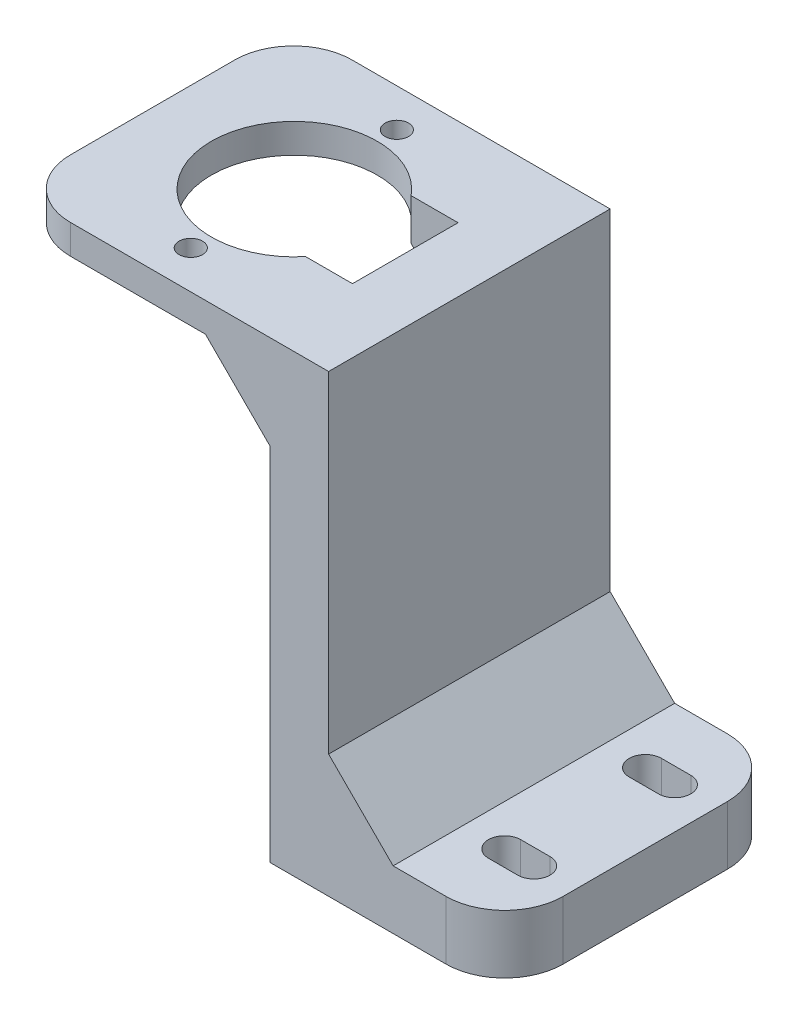
from build123d import *

# Parameters (mm, degrees)
SKETCH1_W                 = 54
SKETCH1_H                 = 48
SKETCH1_R                 = 2
BOSS_EXTRUDE1_DEPTH       = 5
SKETCH2_W                 = 10
SKETCH2_H                 = 48
BOSS_EXTRUDE2_DEPTH       = 72.5
SKETCH3_W                 = 48
SKETCH3_H                 = 10
BOSS_EXTRUDE3_DEPTH       = 30
FILLET1_R                 = 10
CHAMFER1_SIZE             = 11
F_1_0MM_START             = -72.5
F_1_0MM_DOWEL_SLOT1_DEPTH = 10
FILLET2_R                 = 10


# Read off the part's stored shape, not the designer's step: Ø1.0mm Dowel Slot1
with BuildPart() as part:
    # Sketch1 → Boss-Extrude1 (new body)
    with BuildSketch(Plane(origin=(0, 0, 0), x_dir=(1, 0, 0), z_dir=(0, 1, 0))):
        with Locations((3, 0)):
            Rectangle(SKETCH1_W, SKETCH1_H)
        with Locations(Location((0.133743503, 17.499488926, 0), (0, 0, 270))):
            Circle(SKETCH1_R, mode=Mode.SUBTRACT)
        with Locations(Location((0, -17.5, 0), (0, 0, 270))):
            Circle(SKETCH1_R, mode=Mode.SUBTRACT)
        with BuildLine():
            Line((19.068905623, 9), (11.068905623, 9))
            ThreePointArc((11.068905623, 9), (-14, 0), (11.068905623, -9))
            Line((11.068905623, -9), (19.068905623, -9))
            Line((19.068905623, -9), (19.068905623, 9))
        make_face(mode=Mode.SUBTRACT)
    extrude(amount=BOSS_EXTRUDE1_DEPTH)

    # Sketch2 → Boss-Extrude2 (add)
    with BuildSketch(Plane.XZ):
        with Locations((25, 0)):
            Rectangle(SKETCH2_W, SKETCH2_H)
    extrude(amount=BOSS_EXTRUDE2_DEPTH)

    # Sketch3 → Boss-Extrude3 (add)
    with BuildSketch(Plane(origin=(30, 0, 0), x_dir=(0, 0, -1), z_dir=(1, 0, 0))):
        with Locations((0, -67.5)):
            Rectangle(SKETCH3_W, SKETCH3_H)
    extrude(amount=BOSS_EXTRUDE3_DEPTH)

    # Fillet1
    fillet1_edges = [part.edges().sort_by_distance(p)[0] for p in [
        (-24, 2.5, -24),
        (-24, 2.5, 24),
    ]]
    fillet(fillet1_edges, radius=FILLET1_R)

    # Chamfer1
    # the kernel refuses this chamfer: 11 mm, written as the material it adds along each edge
    with BuildSketch(Plane(origin=(20, 0, 24), x_dir=(-0.9996219169112968, 0.027495876610586372, 0), z_dir=(0, 0, -1))) as chamfer1_piece_1_section:
        Polygon((CHAMFER1_SIZE * 0.999621916911, -CHAMFER1_SIZE * 0.0274958766106), (-CHAMFER1_SIZE * 0.0274958766106, -CHAMFER1_SIZE * 0.999621916911), (0, 0), align=None)
    chamfer1_piece_1 = extrude(amount=48, mode=Mode.PRIVATE)
    chamfer1_piece_1 = split(chamfer1_piece_1, bisect_by=Plane(origin=(15.585058089, -3.181005548, 9), z_dir=(0, 0, 1)), keep=Keep.TOP, mode=Mode.PRIVATE)
    chamfer1_piece_1 = chamfer1_piece_1 - Plane(origin=(0.15, -3.181005548, 0), x_dir=(0.7716541076196256, 0, -0.6360424028268551), z_dir=(0, -1, 0)) * Cylinder(14.15, 140, mode=Mode.PRIVATE)
    chamfer1_piece_1 = split(chamfer1_piece_1, bisect_by=Plane(origin=(19.068905623, -3.181005548, 16.524598141), z_dir=(-1, 0, 0)), keep=Keep.TOP, mode=Mode.PRIVATE)
    add(chamfer1_piece_1)
    with BuildSketch(Plane(origin=(20, 0, 24), x_dir=(-0.9996219169112968, 0.027495876610586372, 0), z_dir=(0, 0, -1))) as chamfer1_piece_2_section:
        Polygon((CHAMFER1_SIZE * 0.999621916911, -CHAMFER1_SIZE * 0.0274958766106), (-CHAMFER1_SIZE * 0.0274958766106, -CHAMFER1_SIZE * 0.999621916911), (0, 0), align=None)
    chamfer1_piece_2 = extrude(amount=48, mode=Mode.PRIVATE)
    chamfer1_piece_2 = split(chamfer1_piece_2, bisect_by=Plane(origin=(19.684713813, -5.503387728, 9), z_dir=(0, 0, 1)), keep=Keep.TOP, mode=Mode.PRIVATE)
    chamfer1_piece_2 = split(chamfer1_piece_2, bisect_by=Plane(origin=(19.068905623, -5.503387728, 16.5), z_dir=(1, 0, 0)), keep=Keep.TOP, mode=Mode.PRIVATE)
    add(chamfer1_piece_2)
    with BuildSketch(Plane(origin=(20, 0, 24), x_dir=(-0.9996219169112968, 0.027495876610586372, 0), z_dir=(0, 0, -1))) as chamfer1_piece_3_section:
        Polygon((CHAMFER1_SIZE * 0.999621916911, -CHAMFER1_SIZE * 0.0274958766106), (-CHAMFER1_SIZE * 0.0274958766106, -CHAMFER1_SIZE * 0.999621916911), (0, 0), align=None)
    chamfer1_piece_3 = extrude(amount=48, mode=Mode.PRIVATE)
    chamfer1_piece_3 = split(chamfer1_piece_3, bisect_by=Plane(origin=(19.684713813, -5.503387728, 9), z_dir=(0, 0, -1)), keep=Keep.TOP, mode=Mode.PRIVATE)
    chamfer1_piece_3 = split(chamfer1_piece_3, bisect_by=Plane(origin=(19.068905623, -5.503387728, 0), z_dir=(1, 0, 0)), keep=Keep.TOP, mode=Mode.PRIVATE)
    chamfer1_piece_3 = split(chamfer1_piece_3, bisect_by=Plane(origin=(19.684713813, -5.503387728, -9), z_dir=(0, 0, 1)), keep=Keep.TOP, mode=Mode.PRIVATE)
    add(chamfer1_piece_3)
    with BuildSketch(Plane(origin=(20, 0, 24), x_dir=(-0.9996219169112968, 0.027495876610586372, 0), z_dir=(0, 0, -1))) as chamfer1_piece_4_section:
        Polygon((CHAMFER1_SIZE * 0.999621916911, -CHAMFER1_SIZE * 0.0274958766106), (-CHAMFER1_SIZE * 0.0274958766106, -CHAMFER1_SIZE * 0.999621916911), (0, 0), align=None)
    chamfer1_piece_4 = extrude(amount=48, mode=Mode.PRIVATE)
    chamfer1_piece_4 = chamfer1_piece_4 - Plane(origin=(0.15, -3.181005547, 0), x_dir=(0.7716541076196256, 0, -0.6360424028268551), z_dir=(0, -1, 0)) * Cylinder(14.15, 140, mode=Mode.PRIVATE)
    chamfer1_piece_4 = split(chamfer1_piece_4, bisect_by=Plane(origin=(19.068905623, -3.181005547, -16.524598139), z_dir=(-1, 0, 0)), keep=Keep.TOP, mode=Mode.PRIVATE)
    chamfer1_piece_4 = split(chamfer1_piece_4, bisect_by=Plane(origin=(15.585058087, -3.181005547, -9), z_dir=(0, 0, -1)), keep=Keep.TOP, mode=Mode.PRIVATE)
    add(chamfer1_piece_4)
    with BuildSketch(Plane(origin=(20, 0, 24), x_dir=(-0.9996219169112968, 0.027495876610586372, 0), z_dir=(0, 0, -1))) as chamfer1_piece_5_section:
        Polygon((CHAMFER1_SIZE * 0.999621916911, -CHAMFER1_SIZE * 0.0274958766106), (-CHAMFER1_SIZE * 0.0274958766106, -CHAMFER1_SIZE * 0.999621916911), (0, 0), align=None)
    chamfer1_piece_5 = extrude(amount=48, mode=Mode.PRIVATE)
    chamfer1_piece_5 = split(chamfer1_piece_5, bisect_by=Plane(origin=(19.068905623, -5.503387728, -16.5), z_dir=(1, 0, 0)), keep=Keep.TOP, mode=Mode.PRIVATE)
    chamfer1_piece_5 = split(chamfer1_piece_5, bisect_by=Plane(origin=(19.684713813, -5.503387728, -9), z_dir=(0, 0, -1)), keep=Keep.TOP, mode=Mode.PRIVATE)
    add(chamfer1_piece_5)
    with BuildSketch(Plane(origin=(30, -62.5, -24), x_dir=(-0.02749587661058594, 0.9996219169112968, 0), z_dir=(0, 0, 1))) as chamfer1_piece_6:
        Polygon((CHAMFER1_SIZE * 0.999621916911, -CHAMFER1_SIZE * 0.0274958766106), (-CHAMFER1_SIZE * 0.0274958766106, -CHAMFER1_SIZE * 0.999621916911), (0, 0), align=None)
    extrude(amount=48)

    # Ø1.0mm Dowel Slot1 outline → Ø1.0mm Dowel Slot1 (cut)
    with BuildSketch(Plane(origin=(0, 0, 0), x_dir=(1, 0, 0), z_dir=(0, 1, 0)).offset(F_1_0MM_START)):
        with BuildLine():
            Line((48, 9.25), (53, 9.25))
            ThreePointArc((53, 9.25), (55.75, 12), (53, 14.75))
            Line((53, 14.75), (48, 14.75))
            ThreePointArc((48, 14.75), (45.25, 12), (48, 9.25))
        make_face()
        with BuildLine():
            Line((48, -14.75), (53, -14.75))
            ThreePointArc((53, -14.75), (55.75, -12), (53, -9.25))
            Line((53, -9.25), (48, -9.25))
            ThreePointArc((48, -9.25), (45.25, -12), (48, -14.75))
        make_face()
    extrude(amount=F_1_0MM_DOWEL_SLOT1_DEPTH, mode=Mode.SUBTRACT)

    # Fillet2
    fillet2_edges = [part.edges().sort_by_distance(p)[0] for p in [
        (60, -67.5, 24),
        (60, -67.5, -24),
    ]]
    fillet(fillet2_edges, radius=FILLET2_R)


solid = part.part
